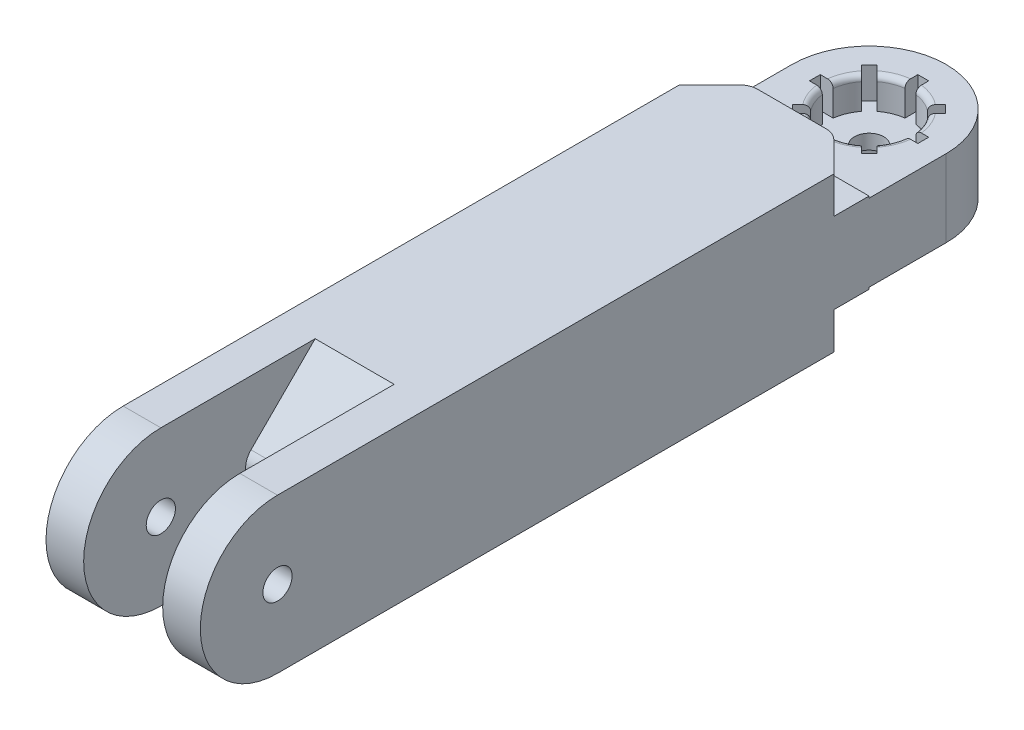
from build123d import *

# Parameters (mm, degrees)
SKETCH1_W               = 42
SKETCH1_H               = 42
BOSS_EXTRUDE1_DEPTH     = 140
SKETCH2_W               = 10.25
SKETCH2_H               = 42
BOSS_EXTRUDE2_DEPTH     = 21
BOSS_EXTRUDE4_DEPTH     = 10.25
BOSS_EXTRUDE5_START     = -10.25
BOSS_EXTRUDE5_DEPTH     = 10.25
SKETCH6_R               = 3.975
CUT_EXTRUDE1_DEPTH      = 186.93832983
SKETCH8_R               = 3.975
CUT_EXTRUDE2_DEPTH      = 186.93832983
SKETCH9_W               = 42
SKETCH9_H               = 21
BOSS_EXTRUDE6_DEPTH     = 21
BOSS_EXTRUDE7_DEPTH     = 21
SKETCH11_R              = 11.35
CUT_EXTRUDE3_DEPTH      = 8.5
CUT_EXTRUDE4_DEPTH      = 21.5
FILLET1_R               = 5
CUT_EXTRUDE5_START      = -8.5
SKETCH18_R              = 11.35
CUT_EXTRUDE5_DEPTH      = 8.5
SKETCH19_R              = 3.975
CUT_EXTRUDE6_DEPTH      = 8.5
FILLET4_R               = 1.5
FILLET5_R               = 1.5
SKETCH20_W              = 2.96
SKETCH20_H              = 3.81
CUT_EXTRUDE7_DEPTH      = 8.5
CIRPATTERN1_COUNT       = 8
MIRROR1_COPY_1_SKETCH_W = 2.96
MIRROR1_COPY_1_SKETCH_H = 3.81
MIRROR1_COPY_1_DEPTH    = 8.5
MIRROR1_COPY_2_SKETCH_W = 2.96
MIRROR1_COPY_2_SKETCH_H = 3.81
MIRROR1_COPY_2_DEPTH    = 8.5
MIRROR1_COPY_3_SKETCH_W = 2.96
MIRROR1_COPY_3_SKETCH_H = 3.81
MIRROR1_COPY_3_DEPTH    = 8.5
MIRROR1_COPY_4_SKETCH_W = 2.96
MIRROR1_COPY_4_SKETCH_H = 3.81
MIRROR1_COPY_4_DEPTH    = 8.5
MIRROR1_COPY_5_SKETCH_W = 2.96
MIRROR1_COPY_5_SKETCH_H = 3.81
MIRROR1_COPY_5_DEPTH    = 8.5
MIRROR1_COPY_6_SKETCH_W = 2.96
MIRROR1_COPY_6_SKETCH_H = 3.81
MIRROR1_COPY_6_DEPTH    = 8.5
MIRROR1_COPY_7_SKETCH_W = 2.96
MIRROR1_COPY_7_SKETCH_H = 3.81
MIRROR1_COPY_7_DEPTH    = 8.5
MIRROR1_COPY_8_SKETCH_W = 2.96
MIRROR1_COPY_8_SKETCH_H = 3.81
MIRROR1_COPY_8_DEPTH    = 8.5
SKETCH25_W              = 32.5
SKETCH25_H              = 50
CUT_EXTRUDE11_DEPTH     = 32
CUT_EXTRUDE12_DEPTH     = 10
FILLET11_R              = 5


with BuildPart() as part:
    # Sketch1 → Boss-Extrude1 (new body)
    with BuildSketch(Plane.XY):
        Rectangle(SKETCH1_W, SKETCH1_H)
    extrude(amount=BOSS_EXTRUDE1_DEPTH)

    # Sketch2 → Boss-Extrude2 (add)
    with BuildSketch(Plane.XY.offset(140)):
        with Locations((-15.875, 0)):
            Rectangle(SKETCH2_W, SKETCH2_H)
        with Locations((15.875, 0)):
            Rectangle(SKETCH2_W, SKETCH2_H)
    extrude(amount=BOSS_EXTRUDE2_DEPTH)

    # Sketch5 → Boss-Extrude4 (add)
    with BuildSketch(Plane.ZY.offset(-10.75)):
        with BuildLine():
            ThreePointArc((161, -21), (182, 0), (161, 21))
            Line((161, 21), (161, -21))
        make_face()
    extrude(amount=-BOSS_EXTRUDE4_DEPTH)

    # Sketch3 → Boss-Extrude5 (add)
    with BuildSketch(Plane(origin=(-10.75, 0, 0), x_dir=(0, 0, -1), z_dir=(1, 0, 0)).offset(BOSS_EXTRUDE5_START)):
        with BuildLine():
            Line((-161, -21), (-161, 21))
            ThreePointArc((-161, 21), (-182, 0), (-161, -21))
        make_face()
    extrude(amount=BOSS_EXTRUDE5_DEPTH)

    # Sketch6 → Cut-Extrude1 (cut, through all)
    with BuildSketch(Plane.ZY.offset(-10.75)):
        with Locations((161, 0)):
            Circle(SKETCH6_R)
    extrude(amount=-CUT_EXTRUDE1_DEPTH, mode=Mode.SUBTRACT)

    # Sketch8 → Cut-Extrude2 (cut, through all)
    with BuildSketch(Plane(origin=(-10.75, 0, 0), x_dir=(0, 0, -1), z_dir=(1, 0, 0))):
        with Locations((-161, 0)):
            Circle(SKETCH8_R)
    extrude(amount=-CUT_EXTRUDE2_DEPTH, mode=Mode.SUBTRACT)

    # Sketch9 → Boss-Extrude6 (add)
    with BuildSketch(Plane(origin=(0, 0, 0), x_dir=(-1, 0, 0), z_dir=(0, 0, -1))):
        Rectangle(SKETCH9_W, SKETCH9_H)
    extrude(amount=BOSS_EXTRUDE6_DEPTH)

    # Sketch10 → Boss-Extrude7 (add)
    with BuildSketch(Plane(origin=(0, -10.5, 0), x_dir=(-1, 0, 0), z_dir=(0, -1, 0))):
        with BuildLine():
            Line((-21, 21), (21, 21))
            ThreePointArc((21, 21), (0, 42), (-21, 21))
        make_face()
    extrude(amount=-BOSS_EXTRUDE7_DEPTH)

    # Sketch11 → Cut-Extrude3 (cut)
    with BuildSketch(Plane(origin=(0, -10.5, 0), x_dir=(-1, 0, 0), z_dir=(0, -1, 0))):
        with Locations((0, 21)):
            Circle(SKETCH11_R)
    extrude(amount=-CUT_EXTRUDE3_DEPTH, mode=Mode.SUBTRACT)

    # Sketch16 → Cut-Extrude4 (cut)
    with BuildSketch(Plane.ZY.offset(-10.75)):
        Polygon((140, -21), (140, 0), (119, -21), align=None)
        Polygon((140, 0), (140, 21), (119, 21), align=None)
    extrude(amount=CUT_EXTRUDE4_DEPTH, mode=Mode.SUBTRACT)

    # Fillet1
    fillet1_edges = [part.edges().sort_by_distance(p)[0] for p in [
        (0, 0, 140),
    ]]
    fillet(fillet1_edges, radius=FILLET1_R)

    # Sketch18 → Cut-Extrude5 (cut)
    with BuildSketch(Plane(origin=(0, 10.5, 0), x_dir=(1, 0, 0), z_dir=(0, 1, 0)).offset(CUT_EXTRUDE5_START)):
        with Locations((0, 21)):
            Circle(SKETCH18_R)
    extrude(amount=CUT_EXTRUDE5_DEPTH, mode=Mode.SUBTRACT)

    # Sketch19 → Cut-Extrude6 (cut)
    with BuildSketch(Plane.XZ.offset(2)):
        with Locations((0, -21)):
            Circle(SKETCH19_R)
    extrude(amount=-CUT_EXTRUDE6_DEPTH, mode=Mode.SUBTRACT)

    # Fillet4
    fillet4_edges = [part.edges().sort_by_distance(p)[0] for p in [
        (11.35, -10.5, -21),
    ]]
    fillet(fillet4_edges, radius=FILLET4_R)

    # Fillet5
    fillet5_edges = [part.edges().sort_by_distance(p)[0] for p in [
        (-11.35, 10.5, -21),
    ]]
    fillet(fillet5_edges, radius=FILLET5_R)

    # Sketch20 → Cut-Extrude7 (cut)
    with BuildSketch(Plane(origin=(0, 10.5, 0), x_dir=(1, 0, 0), z_dir=(0, 1, 0))):
        with Locations((0, 33.85)):
            Rectangle(SKETCH20_W, SKETCH20_H)
    cut_extrude7 = extrude(amount=-CUT_EXTRUDE7_DEPTH, mode=Mode.SUBTRACT)

    # CirPattern1: Cut-Extrude7 ×8 about axis
    cirpattern1_axis = Axis((0, 2, -21), (0, 1, 0))
    for i in range(1, CIRPATTERN1_COUNT):
        add(cut_extrude7.rotate(cirpattern1_axis, i * 360 / CIRPATTERN1_COUNT), mode=Mode.SUBTRACT)

    # Mirror1 copy 1 sketch → Mirror1 copy 1 (cut)
    with BuildSketch(Plane(origin=(14.849242405, -10.5, -6.150757595), x_dir=(0.7071067811865476, 0, -0.7071067811865475), z_dir=(0, -1, 0))):
        with Locations((0, -33.85)):
            Rectangle(MIRROR1_COPY_1_SKETCH_W, MIRROR1_COPY_1_SKETCH_H)
    extrude(amount=-MIRROR1_COPY_1_DEPTH, mode=Mode.SUBTRACT)

    # Mirror1 copy 2 sketch → Mirror1 copy 2 (cut)
    with BuildSketch(Plane(origin=(21, -10.5, -21), x_dir=(0, 0, -1), z_dir=(0, -1, 0))):
        with Locations((0, -33.85)):
            Rectangle(MIRROR1_COPY_2_SKETCH_W, MIRROR1_COPY_2_SKETCH_H)
    extrude(amount=-MIRROR1_COPY_2_DEPTH, mode=Mode.SUBTRACT)

    # Mirror1 copy 3 sketch → Mirror1 copy 3 (cut)
    with BuildSketch(Plane(origin=(14.849242405, -10.5, -35.849242405), x_dir=(-0.7071067811865475, 0, -0.7071067811865476), z_dir=(0, -1, 0))):
        with Locations((0, -33.85)):
            Rectangle(MIRROR1_COPY_3_SKETCH_W, MIRROR1_COPY_3_SKETCH_H)
    extrude(amount=-MIRROR1_COPY_3_DEPTH, mode=Mode.SUBTRACT)

    # Mirror1 copy 4 sketch → Mirror1 copy 4 (cut)
    with BuildSketch(Plane(origin=(0, -10.5, -42), x_dir=(-1, 0, 0), z_dir=(0, -1, 0))):
        with Locations((0, -33.85)):
            Rectangle(MIRROR1_COPY_4_SKETCH_W, MIRROR1_COPY_4_SKETCH_H)
    extrude(amount=-MIRROR1_COPY_4_DEPTH, mode=Mode.SUBTRACT)

    # Mirror1 copy 5 sketch → Mirror1 copy 5 (cut)
    with BuildSketch(Plane(origin=(-14.849242405, -10.5, -35.849242405), x_dir=(-0.7071067811865477, 0, 0.7071067811865475), z_dir=(0, -1, 0))):
        with Locations((0, -33.85)):
            Rectangle(MIRROR1_COPY_5_SKETCH_W, MIRROR1_COPY_5_SKETCH_H)
    extrude(amount=-MIRROR1_COPY_5_DEPTH, mode=Mode.SUBTRACT)

    # Mirror1 copy 6 sketch → Mirror1 copy 6 (cut)
    with BuildSketch(Plane(origin=(-21, -10.5, -21), x_dir=(0, 0, 1), z_dir=(0, -1, 0))):
        with Locations((0, -33.85)):
            Rectangle(MIRROR1_COPY_6_SKETCH_W, MIRROR1_COPY_6_SKETCH_H)
    extrude(amount=-MIRROR1_COPY_6_DEPTH, mode=Mode.SUBTRACT)

    # Mirror1 copy 7 sketch → Mirror1 copy 7 (cut)
    with BuildSketch(Plane(origin=(-14.849242405, -10.5, -6.150757595), x_dir=(0.7071067811865474, 0, 0.7071067811865477), z_dir=(0, -1, 0))):
        with Locations((0, -33.85)):
            Rectangle(MIRROR1_COPY_7_SKETCH_W, MIRROR1_COPY_7_SKETCH_H)
    extrude(amount=-MIRROR1_COPY_7_DEPTH, mode=Mode.SUBTRACT)

    # Mirror1 copy 8 sketch → Mirror1 copy 8 (cut)
    with BuildSketch(Plane.XZ.offset(10.5)):
        with Locations((0, -33.85)):
            Rectangle(MIRROR1_COPY_8_SKETCH_W, MIRROR1_COPY_8_SKETCH_H)
    extrude(amount=-MIRROR1_COPY_8_DEPTH, mode=Mode.SUBTRACT)

    # Sketch25 → Cut-Extrude11 (cut)
    with BuildSketch(Plane.XZ.offset(21)):
        with Locations((0, 36.890344973)):
            Rectangle(SKETCH25_W, SKETCH25_H)
    extrude(amount=-CUT_EXTRUDE11_DEPTH, mode=Mode.SUBTRACT)

    # Sketch25<3> → Cut-Extrude12 (cut)
    with BuildSketch(Plane.XZ.offset(21)):
        Polygon((-21, 0), (-11.394566024, 0), (-21, 9.605433976), align=None)
        Polygon((21, 9.605433976), (11.394566024, 0), (21, 0), align=None)
    cut_extrude12 = extrude(amount=-CUT_EXTRUDE12_DEPTH, mode=Mode.SUBTRACT)

    # Mirror3: Cut-Extrude12 across plane
    add(cut_extrude12.mirror(Plane.ZX), mode=Mode.SUBTRACT)

    # Fillet11
    fillet11_edges = [part.edges().sort_by_distance(p)[0] for p in [
        (-11.394566024, 16, 0),
        (11.394566024, 16, 0),
        (11.394566024, -16, 0),
        (-11.394566024, -16, 0),
    ]]
    fillet(fillet11_edges, radius=FILLET11_R)


solid = part.part
